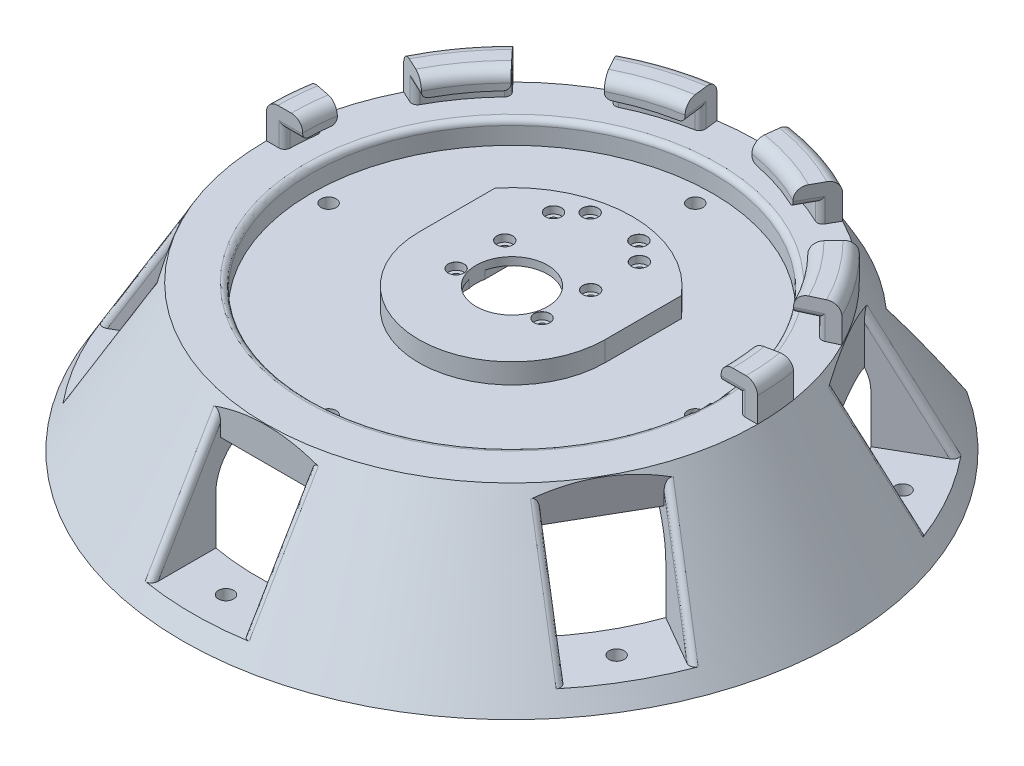
from build123d import *

# Parameters (mm, degrees)
SKETCH2_R                       = 12.5
CUT_EXTRUDE1_DEPTH              = 171.457229262
SKETCH3_R                       = 69.999999954
CUT_EXTRUDE2_DEPTH              = 8.000000002
CUT_EXTRUDE5_DEPTH              = 39
SKETCH8_W                       = 31.75
SKETCH8_H                       = 38.1
CUT_EXTRUDE6_DEPTH              = 44.45
CIRPATTERN2_COUNT               = 6
SKETCH9_R                       = 2.649982
CUT_EXTRUDE7_DEPTH              = 171.457229262
CIRPATTERN3_COUNT               = 6
REVOLVE2_ANGLE                  = 180
CUT_EXTRUDE9_DEPTH              = 12.7
SKETCH3_3_R                     = 12.5
CUT_EXTRUDE11_DEPTH             = 1
CBORE_FOR_M2_5_SHCS1_AT_2_COUNT = 2
CBORE_FOR_M2_5_SHCS1_AT_2_PITCH = 17
CBORE_FOR_M2_5_SHCS1_AT_3_COUNT = 2
CBORE_FOR_M2_5_SHCS1_AT_3_PITCH = 34
CBORE_FOR_M2_5_SHCS1_AT_4_COUNT = 2
CBORE_FOR_M2_5_SHCS1_AT_4_PITCH = 40.820828017
CBORE_FOR_M2_5_SHCS1_AT_5_COUNT = 2
CBORE_FOR_M2_5_SHCS1_AT_5_PITCH = 46.651259361
CBORE_FOR_M2_5_SHCS1_AT_6_COUNT = 2
CBORE_FOR_M2_5_SHCS1_AT_6_PITCH = 45.343136195
CBORE_FOR_M2_5_SHCS1_AT_7_COUNT = 2
CBORE_FOR_M2_5_SHCS1_AT_7_PITCH = 34.481879299
CBORE_FOR_M2_5_SHCS1_AT_8_COUNT = 2
CBORE_FOR_M2_5_SHCS1_AT_8_PITCH = 30
FILLET1_R                       = 4
FILLET2_R                       = 2
FILLET3_R                       = 2
FILLET4_R                       = 2
FILLET5_R                       = 2
FILLET6_R                       = 16
FILLET7_R                       = 16
FILLET8_R                       = 16
FILLET9_R                       = 1
CUT_EXTRUDE12_DEPTH             = 8.05
CUT_EXTRUDE15_START             = -5.3
SKETCH20_R                      = 1.45
CUT_EXTRUDE15_DEPTH             = 5.3
M5_CLEARANCE_HOLE1_D            = 5.3


# Some blends are built 0.0001 mm under size
with BuildPart() as part:
    # Sketch1 → Revolve1 (revolve)
    with BuildSketch(Plane.XY, mode=Mode.PRIVATE) as revolve1_sk:
        Polygon((0, 0), (-85.725, 0), (-115.054393675, -50.8), (0, -50.8), align=None)
    revolve(revolve1_sk.sketch.rotate(Axis((0, 0, 0), (0, -1, 0)), 270), axis=Axis((0, 0, 0), (0, -1, 0)))

    # Sketch2 → Cut-Extrude1 (cut, through all)
    with BuildSketch(Plane(origin=(0, 0, 0), x_dir=(1, 0, 0), z_dir=(0, 1, 0))):
        with Locations(Location((0, 0, 0), (0, 0, 270))):
            Circle(SKETCH2_R)
    extrude(amount=-CUT_EXTRUDE1_DEPTH, mode=Mode.SUBTRACT)

    # Sketch3 → Cut-Extrude2 (cut)
    with BuildSketch(Plane(origin=(0, 0, 0), x_dir=(1, 0, 0), z_dir=(0, 1, 0))):
        with Locations(Location((0, 0, 0), (0, 0, 270))):
            Circle(SKETCH3_R)
        with BuildLine():
            ThreePointArc((32.5, 0), (0, -32.5), (-32.5, 0))
            Line((-32.5, 0), (-32.5, 26.603571189))
            ThreePointArc((-32.5, 26.603571189), (0, 42), (32.5, 26.603571189))
            Line((32.5, 26.603571189), (32.5, 0))
        make_face(mode=Mode.SUBTRACT)
    extrude(amount=-CUT_EXTRUDE2_DEPTH, mode=Mode.SUBTRACT)

    # Sketch7 → Cut-Extrude5 (cut)
    with BuildSketch(Plane.XZ.offset(50.8)):
        with BuildLine():
            Line((-60, -65.598856697), (-60, -161.1))
            Line((-60, -161.1), (60, -161.1))
            Line((60, -161.1), (60, -65.598856697))
            ThreePointArc((60, -65.598856697), (0, 88.9), (-60, -65.598856697))
        make_face()
    extrude(amount=-CUT_EXTRUDE5_DEPTH, mode=Mode.SUBTRACT)

    # Sketch8 → Cut-Extrude6 (cut)
    with BuildSketch(Plane(origin=(0, 0, 0), x_dir=(1, 0, 0), z_dir=(0, 1, 0))):
        with Locations((0, -104.875)):
            Rectangle(SKETCH8_W, SKETCH8_H)
    cut_extrude6 = extrude(amount=-CUT_EXTRUDE6_DEPTH, mode=Mode.SUBTRACT)

    # CirPattern2: Cut-Extrude6 ×6 about axis, 1 skipped
    cirpattern2_axis = Axis((0, 0, 0), (0, -1, 0))
    add([cut_extrude6.rotate(cirpattern2_axis, i * 360 / CIRPATTERN2_COUNT) for i in range(1, CIRPATTERN2_COUNT) if i not in (3,)], mode=Mode.SUBTRACT)

    # Sketch9 → Cut-Extrude7 (cut, through all)
    with BuildSketch(Plane(origin=(0, 0, 0), x_dir=(1, 0, 0), z_dir=(0, 1, 0))):
        with Locations(Location((0, -99.814393675, 0), (0, 0, 270))):
            Circle(SKETCH9_R)
    cut_extrude7 = extrude(amount=-CUT_EXTRUDE7_DEPTH, mode=Mode.SUBTRACT)

    # CirPattern3: Cut-Extrude7 ×6 about axis
    cirpattern3_axis = Axis((0, 0, 0), (0, 1, 0))
    for i in range(1, CIRPATTERN3_COUNT):
        add(cut_extrude7.rotate(cirpattern3_axis, i * 360 / CIRPATTERN3_COUNT), mode=Mode.SUBTRACT)

    # Sketch12 → Revolve2 (revolve)
    with BuildSketch(Plane.XY):
        Polygon((85.725, 0), (85.725, 12.7), (73.025, 12.7), (73.025, 6.35), (79.375, 6.35), (79.375, 0), align=None)
    revolve(axis=Axis((0, 0, 0), (0, 1, 0)), revolution_arc=REVOLVE2_ANGLE)

    # Sketch18 → Cut-Extrude9 (cut)
    with BuildSketch(Plane(origin=(0, 12.7, 0), x_dir=(1, 0, 0), z_dir=(0, 1, 0))):
        Polygon((46.643270314, 89.718478222), (70.913780145, 72.084920653), (36.670415564, 35.160782448), (22.108109665, 45.740916989), align=None)
        Polygon((-15, 100), (-9, 50), (9, 50), (15, 100), align=None)
        Polygon((90.470396714, 45.167547182), (99.740906545, 16.635851693), (50.333978764, 6.891341072), (44.771672865, 24.010358365), align=None)
        Polygon((99.740906545, -16.635851693), (90.470396714, -45.167547182), (44.771672865, -24.010358365), (50.333978764, -6.891341072), align=None)
        Polygon((70.913780145, -72.084920653), (46.643270314, -89.718478222), (22.108109665, -45.740916989), (36.670415564, -35.160782448), align=None)
        Polygon((15, -100), (-15, -100), (-9, -50), (9, -50), align=None)
        Polygon((-46.643270314, -89.718478222), (-70.913780145, -72.084920653), (-36.670415564, -35.160782448), (-22.108109665, -45.740916989), align=None)
        Polygon((-90.470396714, -45.167547182), (-99.740906545, -16.635851693), (-50.333978764, -6.891341072), (-44.771672865, -24.010358365), align=None)
        Polygon((-99.740906545, 16.635851693), (-90.470396714, 45.167547182), (-44.771672865, 24.010358365), (-50.333978764, 6.891341072), align=None)
        Polygon((-70.913780145, 72.084920653), (-46.643270314, 89.718478222), (-22.108109665, 45.740916989), (-36.670415564, 35.160782448), align=None)
    extrude(amount=-CUT_EXTRUDE9_DEPTH, mode=Mode.SUBTRACT)

    # Sketch3<3> → Cut-Extrude11 (cut)
    # profile 1 of 5: a face of its own
    with BuildSketch(Plane(origin=(0, 0, 0), x_dir=(1, 0, 0), z_dir=(0, 1, 0))):
        with BuildLine():
            ThreePointArc((-18.668154703, 26.603571189), (-28.835438507, 14.992247533), (-32.5, 0))
            ThreePointArc((-32.5, 0), (0, -32.5), (32.5, 0))
            ThreePointArc((32.5, 0), (28.835438507, 14.992247533), (18.668154703, 26.603571189))
            Line((18.668154703, 26.603571189), (-18.668154703, 26.603571189))
        make_face()
        with Locations(Location((0, 0, 0), (0, 0, 270))):
            Circle(SKETCH3_3_R, mode=Mode.SUBTRACT)
    # profile 2 of 5: a face of its own
    with BuildSketch(Plane(origin=(0, 0, 0), x_dir=(1, 0, 0), z_dir=(0, 1, 0))):
        with BuildLine():
            Line((-32.5, 26.603571189), (-32.5, 0))
            ThreePointArc((-32.5, 0), (-28.835438507, 14.992247533), (-18.668154703, 26.603571189))
            Line((-18.668154703, 26.603571189), (-32.5, 26.603571189))
        make_face()
    # profile 3 of 5: a face of its own
    with BuildSketch(Plane(origin=(0, 0, 0), x_dir=(1, 0, 0), z_dir=(0, 1, 0))):
        with BuildLine():
            ThreePointArc((18.668154703, 26.603571189), (0, 32.5), (-18.668154703, 26.603571189))
            Line((-18.668154703, 26.603571189), (18.668154703, 26.603571189))
        make_face()
    # profile 4 of 5: a face of its own
    with BuildSketch(Plane(origin=(0, 0, 0), x_dir=(1, 0, 0), z_dir=(0, 1, 0))):
        with BuildLine():
            ThreePointArc((32.5, 26.603571189), (0, 42), (-32.5, 26.603571189))
            Line((-32.5, 26.603571189), (-18.668154703, 26.603571189))
            ThreePointArc((-18.668154703, 26.603571189), (0, 32.5), (18.668154703, 26.603571189))
            Line((18.668154703, 26.603571189), (32.5, 26.603571189))
        make_face()
    # profile 5 of 5: a face of its own
    with BuildSketch(Plane(origin=(0, 0, 0), x_dir=(1, 0, 0), z_dir=(0, 1, 0))):
        with BuildLine():
            ThreePointArc((18.668154703, 26.603571189), (28.835438507, 14.992247533), (32.5, 0))
            Line((32.5, 0), (32.5, 26.603571189))
            Line((32.5, 26.603571189), (18.668154703, 26.603571189))
        make_face()
    extrude(amount=-CUT_EXTRUDE11_DEPTH, mode=Mode.SUBTRACT)

    # Sketch24 → CBORE for M2.5 SHCS1 (revolve, cut)
    with BuildSketch(Plane(origin=(-15, -1, 4.5), x_dir=(0, 0, 1), z_dir=(1, 0, 0))):
        Polygon((0, 0), (0, 49.8), (1.45, 49.8), (1.45, 2.5), (2.75, 2.5), (2.75, 0.025), (2.775, 0), align=None)
    cbore_for_m2_5_shcs1 = revolve(axis=Axis((-15, 5.35, 4.5), (0, -1, 0)), mode=Mode.SUBTRACT)

    # CBORE for M2.5 SHCS1 at 2: CBORE for M2.5 SHCS1 ×2
    with Locations(*[(0, 0, -i * CBORE_FOR_M2_5_SHCS1_AT_2_PITCH) for i in range(1, CBORE_FOR_M2_5_SHCS1_AT_2_COUNT)]):
        add(cbore_for_m2_5_shcs1, mode=Mode.SUBTRACT)

    # CBORE for M2.5 SHCS1 at 3: CBORE for M2.5 SHCS1 ×2
    with Locations(*[(0, 0, -i * CBORE_FOR_M2_5_SHCS1_AT_3_PITCH) for i in range(1, CBORE_FOR_M2_5_SHCS1_AT_3_COUNT)]):
        add(cbore_for_m2_5_shcs1, mode=Mode.SUBTRACT)

    # CBORE for M2.5 SHCS1 at 4: CBORE for M2.5 SHCS1 ×2
    with Locations(*[Vector(0.15923243882462063, 0, -0.9872411207126472) * (i * CBORE_FOR_M2_5_SHCS1_AT_4_PITCH) for i in range(1, CBORE_FOR_M2_5_SHCS1_AT_4_COUNT)]):
        add(cbore_for_m2_5_shcs1, mode=Mode.SUBTRACT)

    # CBORE for M2.5 SHCS1 at 5: CBORE for M2.5 SHCS1 ×2
    with Locations(*[Vector(0.5037377408822789, 0, -0.8638566364917376) * (i * CBORE_FOR_M2_5_SHCS1_AT_5_PITCH) for i in range(1, CBORE_FOR_M2_5_SHCS1_AT_5_COUNT)]):
        add(cbore_for_m2_5_shcs1, mode=Mode.SUBTRACT)

    # CBORE for M2.5 SHCS1 at 6: CBORE for M2.5 SHCS1 ×2
    with Locations(*[Vector(0.6616216370868465, 0, -0.7498378553650925) * (i * CBORE_FOR_M2_5_SHCS1_AT_6_PITCH) for i in range(1, CBORE_FOR_M2_5_SHCS1_AT_6_COUNT)]):
        add(cbore_for_m2_5_shcs1, mode=Mode.SUBTRACT)

    # CBORE for M2.5 SHCS1 at 7: CBORE for M2.5 SHCS1 ×2
    with Locations(*[Vector(0.8700221858486125, 0, -0.4930125719808802) * (i * CBORE_FOR_M2_5_SHCS1_AT_7_PITCH) for i in range(1, CBORE_FOR_M2_5_SHCS1_AT_7_COUNT)]):
        add(cbore_for_m2_5_shcs1, mode=Mode.SUBTRACT)

    # CBORE for M2.5 SHCS1 at 8: CBORE for M2.5 SHCS1 ×2
    with Locations(*[(i * CBORE_FOR_M2_5_SHCS1_AT_8_PITCH, 0, 0) for i in range(1, CBORE_FOR_M2_5_SHCS1_AT_8_COUNT)]):
        add(cbore_for_m2_5_shcs1, mode=Mode.SUBTRACT)

    # Fillet1
    fillet1_edges = [part.edges().sort_by_distance(p)[0] for p in [
        (-85.450905057, 12.7, -6.849704366),
        (-72.808821363, 12.7, -5.614815819),
        (-59.078466014, 12.7, -42.923018049),
        (-22.565966014, 12.7, -69.450902102),
        (22.565966014, 12.7, -69.450902102),
        (59.078466014, 12.7, -42.923018049),
        (72.808821363, 12.7, -5.614815819),
        (-69.352981843, 12.7, -50.387890753),
        (-26.490481843, 12.7, -81.529319859),
        (26.490481843, 12.7, -81.529319859),
        (69.352981843, 12.7, -50.387890753),
        (85.450905057, 12.7, -6.849704365),
    ]]
    fillet(fillet1_edges, radius=FILLET1_R)

    # Fillet2
    fillet2_edges = [part.edges().sort_by_distance(p)[0] for p in [
        (-76.2, 6.35, 0),
        (76.2, 6.35, 0),
        (67.844410645, 6.35, -34.692369341),
        (75.278944251, 6.35, -11.811227656),
        (34.49561812, 6.35, -67.9446604),
        (53.95947979, 6.35, -53.803337137),
        (-75.278944251, 6.35, -11.811227656),
        (-67.844410645, 6.35, -34.692369341),
        (-53.95947979, 6.35, -53.803337137),
        (-34.49561812, 6.35, -67.9446604),
        (12.029328065, 6.35, -75.24440054),
        (-12.029328065, 6.35, -75.24440054),
    ]]
    fillet(fillet2_edges, radius=FILLET2_R)

    # Fillet3
    fillet3_edges = [part.edges().sort_by_distance(p)[0] for p in [
        (-78.396323126, 4.175, -12.426067172),
        (-56.120098678, 4.175, -56.133102082),
        (-70.727816733, 4.175, -36.027303052),
        (-12.407903987, 4.175, -78.399199892),
        (56.120098678, 4.175, -56.133102082),
        (78.396323126, 4.175, -12.426067171),
        (-79.375, 4.175, 0),
        (-36.043688298, 4.175, -70.719468033),
        (12.407903987, 4.175, -78.399199892),
        (36.043688298, 4.175, -70.719468033),
        (70.727816733, 4.175, -36.027303052),
        (79.375, 4.175, 0),
    ]]
    fillet(fillet3_edges, radius=FILLET3_R)

    # Fillet4
    fillet4_edges = [part.edges().sort_by_distance(p)[0] for p in [
        (92.853698409, -23.56380487, 35.278236725),
        (76.978698409, -23.56380487, 62.774543295),
        (76.978698409, -23.56380487, -62.774543295),
        (92.853698409, -23.56380487, -35.278236725),
        (-92.853698409, -23.56380487, -35.278236725),
        (-76.978698409, -23.56380487, -62.774543295),
        (-76.978698409, -23.56380487, 62.774543295),
        (-92.853698409, -23.56380487, 35.278236725),
        (15.875, -23.56380487, 98.05278002),
        (-15.875, -23.56380487, 98.05278002),
    ]]
    fillet(fillet4_edges, radius=FILLET4_R)

    # Fillet5
    fillet5_edges = [part.edges().sort_by_distance(p)[0] for p in [
        (0, 0, -69.999999954),
    ]]
    fillet(fillet5_edges, radius=FILLET5_R)

    # Fillet6
    # the kernel refuses this fillet: 16 mm, written as the material it adds along each edge
    with BuildSketch(Plane(origin=(0, -11.8, 0), x_dir=(0.26715940650180947, 0, 0.9636523499258438), z_dir=(0.9636523499258438, 0, -0.26715940650180947))) as fillet6_piece_1_section:
        with BuildLine():
            CenterArc((88.9 - FILLET6_R, FILLET6_R), FILLET6_R, 270, 90)
            Line((88.9, FILLET6_R), (88.9, 0))
            Line((88.9, 0), (88.9 - FILLET6_R, 0))
        make_face()
    fillet6_piece_1 = revolve(axis=Axis((0, -11.8, 0), (0, -1, 0)), revolution_arc=90.990609321, mode=Mode.PRIVATE)
    fillet6_piece_1 = split(fillet6_piece_1, bisect_by=Plane(origin=(15.875, -14.981885519, 82.675852162), z_dir=(1, 0, 0)), keep=Keep.TOP, mode=Mode.PRIVATE)
    add(fillet6_piece_1)
    with BuildSketch(Plane(origin=(0, -11.8, 0), x_dir=(0.26715940650180947, 0, 0.9636523499258438), z_dir=(0.9636523499258438, 0, -0.26715940650180947))) as fillet6_piece_2_section:
        with BuildLine():
            CenterArc((88.9 - FILLET6_R, FILLET6_R), FILLET6_R, 270, 90)
            Line((88.9, FILLET6_R), (88.9, 0))
            Line((88.9, 0), (88.9 - FILLET6_R, 0))
        make_face()
    fillet6_piece_2 = revolve(axis=Axis((0, -11.8, 0), (0, -1, 0)), revolution_arc=90.990609321, mode=Mode.PRIVATE)
    fillet6_piece_2 = split(fillet6_piece_2, bisect_by=Plane(origin=(-54.96696383, -15.341247378, 50.066062411), z_dir=(0.5000000000000001, 0, 0.8660254037844386)), keep=Keep.TOP, mode=Mode.PRIVATE)
    fillet6_piece_2 = split(fillet6_piece_2, bisect_by=Plane(origin=(-15.875, -15.341247378, 72.635817925), z_dir=(-1, 0, 0)), keep=Keep.TOP, mode=Mode.PRIVATE)
    add(fillet6_piece_2)
    with BuildSketch(Plane(origin=(0, -11.8, 0), x_dir=(0.26715940650180947, 0, 0.9636523499258438), z_dir=(0.9636523499258438, 0, -0.26715940650180947))) as fillet6_piece_3_section:
        with BuildLine():
            CenterArc((88.9 - FILLET6_R, FILLET6_R), FILLET6_R, 270, 90)
            Line((88.9, FILLET6_R), (88.9, 0))
            Line((88.9, 0), (88.9 - FILLET6_R, 0))
        make_face()
    fillet6_piece_3 = revolve(axis=Axis((0, -11.8, 0), (0, -1, 0)), revolution_arc=90.990609321, mode=Mode.PRIVATE)
    fillet6_piece_3 = split(fillet6_piece_3, bisect_by=Plane(origin=(-79.536888464, -14.981885707, 27.589772918), z_dir=(-0.5000000000000001, 0, -0.8660254037844386)), keep=Keep.TOP, mode=Mode.PRIVATE)
    add(fillet6_piece_3)
    with BuildSketch(Plane(origin=(0, -11.8, 0), x_dir=(0.7009677122014474, 0, -0.7131930078534623), z_dir=(-0.7131930078534623, 0, -0.7009677122014474))) as fillet6_piece_4_section:
        with BuildLine():
            CenterArc((88.9 - FILLET6_R, FILLET6_R), FILLET6_R, 270, 90)
            Line((88.9, FILLET6_R), (88.9, 0))
            Line((88.9, 0), (88.9 - FILLET6_R, 0))
        make_face()
    fillet6_piece_4 = revolve(axis=Axis((0, -11.8, 0), (0, -1, 0)), revolution_arc=90.990609321, mode=Mode.PRIVATE)
    fillet6_piece_4 = split(fillet6_piece_4, bisect_by=Plane(origin=(70.84196383, -15.341247378, 22.56975584), z_dir=(0.5000000000000001, 0, -0.8660254037844386)), keep=Keep.TOP, mode=Mode.PRIVATE)
    fillet6_piece_4 = split(fillet6_piece_4, bisect_by=Plane(origin=(70.841963547, -15.341247378, -22.569755677), z_dir=(0.5000000000000004, 0, 0.8660254037844384)), keep=Keep.TOP, mode=Mode.PRIVATE)
    add(fillet6_piece_4)
    with BuildSketch(Plane(origin=(0, -11.8, 0), x_dir=(0.7009677122014474, 0, -0.7131930078534623), z_dir=(-0.7131930078534623, 0, -0.7009677122014474))) as fillet6_piece_5_section:
        with BuildLine():
            CenterArc((88.9 - FILLET6_R, FILLET6_R), FILLET6_R, 270, 90)
            Line((88.9, FILLET6_R), (88.9, 0))
            Line((88.9, 0), (88.9 - FILLET6_R, 0))
        make_face()
    fillet6_piece_5 = revolve(axis=Axis((0, -11.8, 0), (0, -1, 0)), revolution_arc=90.990609321, mode=Mode.PRIVATE)
    fillet6_piece_5 = split(fillet6_piece_5, bisect_by=Plane(origin=(63.661888464, -14.981885707, 55.086079488), z_dir=(-0.5000000000000001, 0, 0.8660254037844386)), keep=Keep.TOP, mode=Mode.PRIVATE)
    add(fillet6_piece_5)
    with BuildSketch(Plane(origin=(0, -11.8, 0), x_dir=(0.9681271187032567, 0, 0.2504593420723819), z_dir=(0.2504593420723819, 0, -0.9681271187032567))) as fillet6_piece_6_section:
        with BuildLine():
            CenterArc((88.9 - FILLET6_R, FILLET6_R), FILLET6_R, 270, 90)
            Line((88.9, FILLET6_R), (88.9, 0))
            Line((88.9, 0), (88.9 - FILLET6_R, 0))
        make_face()
    fillet6_piece_6 = revolve(axis=Axis((0, -11.8, 0), (0, -1, 0)), revolution_arc=90.990609321, mode=Mode.PRIVATE)
    fillet6_piece_6 = split(fillet6_piece_6, bisect_by=Plane(origin=(79.536888252, -14.981885519, 27.589772796), z_dir=(0.5000000000000001, 0, -0.8660254037844386)), keep=Keep.TOP, mode=Mode.PRIVATE)
    add(fillet6_piece_6)
    with BuildSketch(Plane(origin=(0, -11.8, 0), x_dir=(0.9681271187032567, 0, 0.2504593420723819), z_dir=(0.2504593420723819, 0, -0.9681271187032567))) as fillet6_piece_7_section:
        with BuildLine():
            CenterArc((88.9 - FILLET6_R, FILLET6_R), FILLET6_R, 270, 90)
            Line((88.9, FILLET6_R), (88.9, 0))
            Line((88.9, 0), (88.9 - FILLET6_R, 0))
        make_face()
    fillet6_piece_7 = revolve(axis=Axis((0, -11.8, 0), (0, -1, 0)), revolution_arc=90.990609321, mode=Mode.PRIVATE)
    fillet6_piece_7 = split(fillet6_piece_7, bisect_by=Plane(origin=(54.966963547, -15.341247378, 50.066062247), z_dir=(-0.5000000000000001, 0, 0.8660254037844386)), keep=Keep.TOP, mode=Mode.PRIVATE)
    fillet6_piece_7 = split(fillet6_piece_7, bisect_by=Plane(origin=(15.875, -15.341247378, 72.635818251), z_dir=(1, 0, 0)), keep=Keep.TOP, mode=Mode.PRIVATE)
    add(fillet6_piece_7)
    with BuildSketch(Plane(origin=(0, -11.8, 0), x_dir=(0.9681271187032567, 0, 0.2504593420723819), z_dir=(0.2504593420723819, 0, -0.9681271187032567))) as fillet6_piece_8_section:
        with BuildLine():
            CenterArc((88.9 - FILLET6_R, FILLET6_R), FILLET6_R, 270, 90)
            Line((88.9, FILLET6_R), (88.9, 0))
            Line((88.9, 0), (88.9 - FILLET6_R, 0))
        make_face()
    fillet6_piece_8 = revolve(axis=Axis((0, -11.8, 0), (0, -1, 0)), revolution_arc=90.990609321, mode=Mode.PRIVATE)
    fillet6_piece_8 = split(fillet6_piece_8, bisect_by=Plane(origin=(-15.875, -14.981885707, 82.675852407), z_dir=(-1, 0, 0)), keep=Keep.TOP, mode=Mode.PRIVATE)
    add(fillet6_piece_8)
    with BuildSketch(Plane(origin=(0, -11.8, 0), x_dir=(-0.7009677122014484, 0, 0.7131930078534614), z_dir=(0.7131930078534614, 0, 0.7009677122014484))) as fillet6_piece_9_section:
        with BuildLine():
            CenterArc((88.9 - FILLET6_R, FILLET6_R), FILLET6_R, 270, 90)
            Line((88.9, FILLET6_R), (88.9, 0))
            Line((88.9, 0), (88.9 - FILLET6_R, 0))
        make_face()
    fillet6_piece_9 = revolve(axis=Axis((0, -11.8, 0), (0, -1, 0)), revolution_arc=90.990609321, mode=Mode.PRIVATE)
    fillet6_piece_9 = split(fillet6_piece_9, bisect_by=Plane(origin=(-63.661888252, -14.981885519, 55.086079366), z_dir=(0.5000000000000001, 0, 0.8660254037844386)), keep=Keep.TOP, mode=Mode.PRIVATE)
    add(fillet6_piece_9)
    with BuildSketch(Plane(origin=(0, -11.8, 0), x_dir=(-0.7009677122014484, 0, 0.7131930078534614), z_dir=(0.7131930078534614, 0, 0.7009677122014484))) as fillet6_piece_10_section:
        with BuildLine():
            CenterArc((88.9 - FILLET6_R, FILLET6_R), FILLET6_R, 270, 90)
            Line((88.9, FILLET6_R), (88.9, 0))
            Line((88.9, 0), (88.9 - FILLET6_R, 0))
        make_face()
    fillet6_piece_10 = revolve(axis=Axis((0, -11.8, 0), (0, -1, 0)), revolution_arc=90.990609321, mode=Mode.PRIVATE)
    fillet6_piece_10 = split(fillet6_piece_10, bisect_by=Plane(origin=(-70.84196383, -15.341247378, -22.56975584), z_dir=(-0.49999999999999983, 0, 0.8660254037844388)), keep=Keep.TOP, mode=Mode.PRIVATE)
    fillet6_piece_10 = split(fillet6_piece_10, bisect_by=Plane(origin=(-70.841963547, -15.341247378, 22.569755677), z_dir=(-0.5000000000000001, 0, -0.8660254037844386)), keep=Keep.TOP, mode=Mode.PRIVATE)
    add(fillet6_piece_10)

    # Fillet7
    fillet7_edges = [part.edges().sort_by_distance(p)[0] for p in [
        (64.036031191, -11.8, -61.665198526),
    ]]
    fillet(fillet7_edges, radius=FILLET7_R - 0.0001)  # a hair under: the kernel refuses the full size

    # Fillet8
    # the kernel refuses this fillet: 16 mm, written as the material it adds along each edge
    with BuildSketch(Plane(origin=(0, -11.8, 0), x_dir=(-0.9681187273777495, 0, -0.25049177571426695), z_dir=(-0.25049177571426695, 0, 0.9681187273777495))) as fillet8_piece_1_section:
        with BuildLine():
            CenterArc((88.9 - FILLET8_R, FILLET8_R), FILLET8_R, 270, 90)
            Line((88.9 - FILLET8_R, 0), (88.9, 0))
            Line((88.9, 0), (88.9, FILLET8_R))
        make_face()
    fillet8_piece_1 = revolve(axis=Axis((0, -11.8, 0), (0, -1, 0)), revolution_arc=58.825731772, mode=Mode.PRIVATE)
    fillet8_piece_1 = split(fillet8_piece_1, bisect_by=Plane(origin=(-74.398229209, -13.906298809, -42.788487017), z_dir=(0.8660254037844388, 0, 0.49999999999999983)), keep=Keep.TOP, mode=Mode.PRIVATE)
    fillet8_piece_1 = split(fillet8_piece_1, bisect_by=Plane(origin=(-60, -13.906298809, -41.216396761), z_dir=(-1, 0, 0)), keep=Keep.TOP, mode=Mode.PRIVATE)
    add(fillet8_piece_1)
    with BuildSketch(Plane(origin=(0, -11.8, 0), x_dir=(-0.9681187273777495, 0, -0.25049177571426695), z_dir=(-0.25049177571426695, 0, 0.9681187273777495))) as fillet8_piece_2_section:
        with BuildLine():
            CenterArc((88.9 - FILLET8_R, FILLET8_R), FILLET8_R, 270, 90)
            Line((88.9 - FILLET8_R, 0), (88.9, 0))
            Line((88.9, 0), (88.9, FILLET8_R))
        make_face()
    fillet8_piece_2 = revolve(axis=Axis((0, -11.8, 0), (0, -1, 0)), revolution_arc=58.825731772, mode=Mode.PRIVATE)
    fillet8_piece_2 = split(fillet8_piece_2, bisect_by=Plane(origin=(-66.903440173, -17.970411927, -56.957590241), z_dir=(0.4999999999999998, 0, -0.8660254037844388)), keep=Keep.TOP, mode=Mode.PRIVATE)
    fillet8_piece_2 = split(fillet8_piece_2, bisect_by=Plane(origin=(-60, -17.970411927, -59.221513101), z_dir=(-1, 0, 0)), keep=Keep.TOP, mode=Mode.PRIVATE)
    add(fillet8_piece_2)

    # Fillet9
    fillet9_edges = [part.edges().sort_by_distance(p)[0] for p in [
        (-60, -31.116866881, -84.56763471),
        (60, -31.116866881, -84.56763471),
    ]]
    fillet(fillet9_edges, radius=FILLET9_R)

    # Sketch28 → Cut-Extrude12 (cut)
    with BuildSketch(Plane.XZ.offset(11.8)):
        with BuildLine():
            Line((9.2, 12), (-9.2, 12))
            ThreePointArc((-9.2, 12), (-11.321320344, 11.121320344), (-12.2, 9))
            Line((-12.2, 9), (-12.2, -30))
            ThreePointArc((-12.2, -30), (-11.321320344, -32.121320344), (-9.2, -33))
            Line((-9.2, -33), (9.2, -33))
            ThreePointArc((9.2, -33), (11.321320344, -32.121320344), (12.2, -30))
            Line((12.2, -30), (12.2, 9))
            ThreePointArc((12.2, 9), (11.321320344, 11.121320344), (9.2, 12))
        make_face()
    extrude(amount=-CUT_EXTRUDE12_DEPTH, mode=Mode.SUBTRACT)

    # Sketch20 → Cut-Extrude15 (cut)
    with BuildSketch(Plane.XZ.offset(11.8).offset(CUT_EXTRUDE15_START)):
        Polygon((-22.5, 20), (-22.5, -33), (-12.5, -40), (12.5, -40), (22.5, -33), (22.5, 20), align=None)
        with Locations(Location((-15, -29.5, 0), (0, 0, 90))):
            Circle(SKETCH20_R, mode=Mode.SUBTRACT)
        with Locations(Location((-8.5, -35.8, 0), (0, 0, 90))):
            Circle(SKETCH20_R, mode=Mode.SUBTRACT)
        with Locations(Location((-15, -12.5, 0), (0, 0, 90))):
            Circle(SKETCH20_R, mode=Mode.SUBTRACT)
        with BuildLine():
            Line((-9.2, 12), (-3.5, 12))
            ThreePointArc((-3.5, 12), (-1.767766953, 12.374368671), (0, 12.5))
            ThreePointArc((0, 12.5), (1.767766953, 12.374368671), (3.5, 12))
            Line((3.5, 12), (9.2, 12))
            ThreePointArc((9.2, 12), (11.321320344, 11.121320344), (12.2, 9))
            Line((12.2, 9), (12.2, 2.722131518))
            ThreePointArc((12.2, 2.722131518), (12.5, 0), (12.2, -2.722131518))
            Line((12.2, -2.722131518), (12.2, -30))
            ThreePointArc((12.2, -30), (11.321320344, -32.121320344), (9.2, -33))
            Line((9.2, -33), (-9.2, -33))
            ThreePointArc((-9.2, -33), (-11.321320344, -32.121320344), (-12.2, -30))
            Line((-12.2, -30), (-12.2, -2.722131518))
            ThreePointArc((-12.2, -2.722131518), (-12.5, 0), (-12.2, 2.722131518))
            Line((-12.2, 2.722131518), (-12.2, 9))
            ThreePointArc((-12.2, 9), (-11.321320344, 11.121320344), (-9.2, 12))
        make_face(mode=Mode.SUBTRACT)
        with Locations(Location((8.5, -35.8, 0), (0, 0, 90))):
            Circle(SKETCH20_R, mode=Mode.SUBTRACT)
        with Locations(Location((15, -29.5, 0), (0, 0, 90))):
            Circle(SKETCH20_R, mode=Mode.SUBTRACT)
        with Locations(Location((15, -12.5, 0), (0, 0, 90))):
            Circle(SKETCH20_R, mode=Mode.SUBTRACT)
        with Locations(Location((-15, 4.5, 0), (0, 0, 90))):
            Circle(SKETCH20_R, mode=Mode.SUBTRACT)
        with Locations(Location((15, 4.5, 0), (0, 0, 90))):
            Circle(SKETCH20_R, mode=Mode.SUBTRACT)
    extrude(amount=CUT_EXTRUDE15_DEPTH, mode=Mode.SUBTRACT)

    # M5 Clearance Hole1 (through all)
    with Locations(Plane(origin=(0, -8.000000002, 0), x_dir=(1, 0, 0), z_dir=(0, 1, 0))):
        with Locations((0, 64), (64, 0), (0, -64), (-64, 0)):
            Hole(M5_CLEARANCE_HOLE1_D / 2)


solid = part.part
